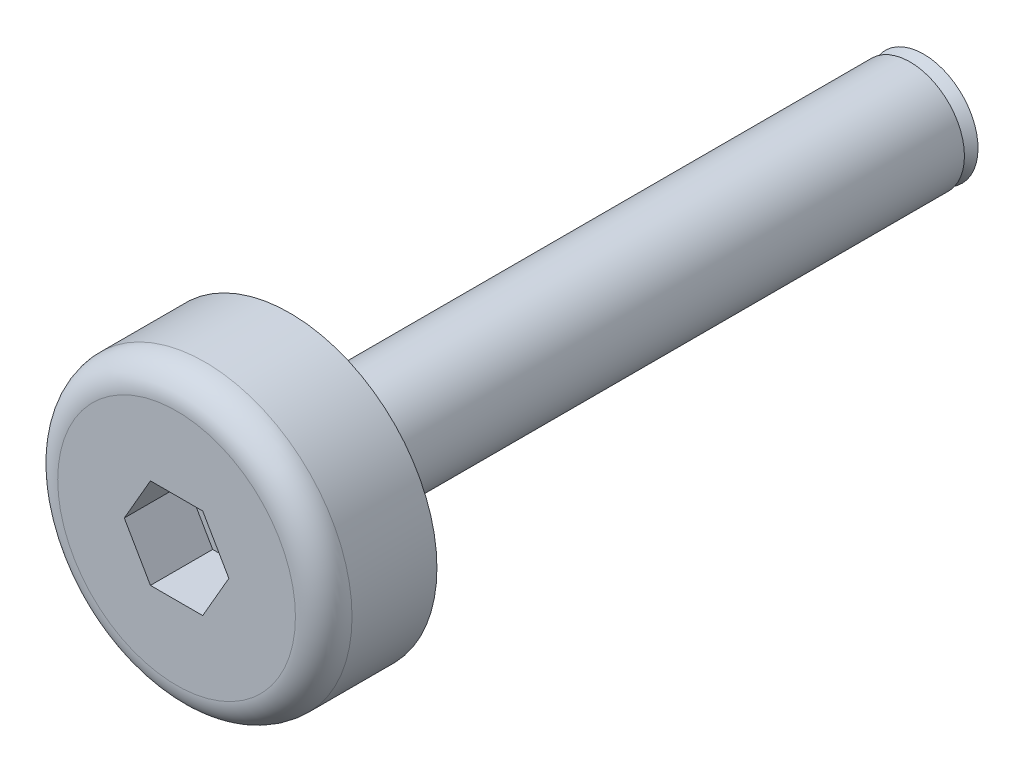
from build123d import *

# Parameters (mm, degrees)
F_0045_CYLINDER_SKETCH_R    = 3.25
F_0045_CYLINDER_DEPTH       = 2.5
F_0046_FILLET_R             = 0.625
F_0047_EXTRUDE_DEPTH        = 1.385
F_0047_EXTRUDE_ROTATE_ANGLE = 120
F_0050_CYLINDER_SKETCH_R    = 1.2
F_0050_CYLINDER_DEPTH       = 13.7
F_0051_CONE_ROTATE_ANGLE    = 90


with BuildPart() as part:
    # 0045_cylinder_Sketch → 0045_cylinder (new body)
    with BuildSketch(Plane.XY):
        Circle(F_0045_CYLINDER_SKETCH_R)
    extrude(amount=F_0045_CYLINDER_DEPTH)

    # 0046_fillet
    f_0046_fillet_edges = [part.edges().sort_by_distance(p)[0] for p in [
        (-3.25, 0, 2.5),
    ]]
    fillet(f_0046_fillet_edges, radius=F_0046_FILLET_R)


with BuildPart() as body_2:
    # 0047_extrude_Sketch → 0047_extrude (new body)
    with BuildSketch(Plane.XY):
        Polygon((0, 0), (1.154700538, 0), (1.732050808, 1), (1.154700538, 2), (0, 2), (-0.577350269, 1), align=None)
    extrude(amount=F_0047_EXTRUDE_DEPTH)


with BuildPart() as body_2_1:
    # 0047_extrude_Rotate: read off the stored shape, not the designer's step
    # 0047_extrude_Rotate: moved
    add(body_2.part.rotate(Axis((0, 0, 0), (0, 0, 1)), F_0047_EXTRUDE_ROTATE_ANGLE))


with BuildPart() as body_2_2:
    # 0047_extrude_Translate: moved
    add(body_2_1.part.moved(Location((1.154700538, 0, 1.125))))


with BuildPart() as part_1:
    add(part.part)

    # 0049_sub: cut body 2
    add(body_2_2.part, mode=Mode.SUBTRACT)


with BuildPart() as body_2_2_1:
    # 0050_cylinder_Sketch → 0050_cylinder (new body)
    with BuildSketch(Plane.XY):
        Circle(F_0050_CYLINDER_SKETCH_R)
    extrude(amount=F_0050_CYLINDER_DEPTH)


with BuildPart() as body_2_2_2:
    # 0050_cylinder_Translate: moved
    add(body_2_2_1.part.moved(Location((0, 0, -13.7))))


with BuildPart() as body_3:
    # 0051_cone_Sketch → 0051_cone (revolve)
    with BuildSketch(Plane.XY, mode=Mode.PRIVATE) as f_0051_cone_sk:
        Polygon((0, 0), (1.2, 0), (0.9, 0.3), (0, 0.3), align=None)
    revolve(f_0051_cone_sk.sketch.rotate(Axis((0, -100, 0), (0, 1, 0)), 90), axis=Axis((0, -100, 0), (0, 1, 0)))


with BuildPart() as body_3_1:
    # 0051_cone_Rotate: moved
    add(body_3.part.rotate(Axis((0, 0, 0), (1, 0, 0)), F_0051_CONE_ROTATE_ANGLE))


with BuildPart() as body_3_2:
    # 0051_cone_Translate: moved
    add(body_3_1.part.moved(Location((0, 0, -14))))


with BuildPart() as body_2_2_3:
    add(body_2_2_2.part)

    # 0053_add: union body 3
    add(body_3_2.part)


with BuildPart() as part_2:
    add(part_1.part)

    # 0054_add: union body 2 2
    add(body_2_2_3.part)


solid = part_2.part
